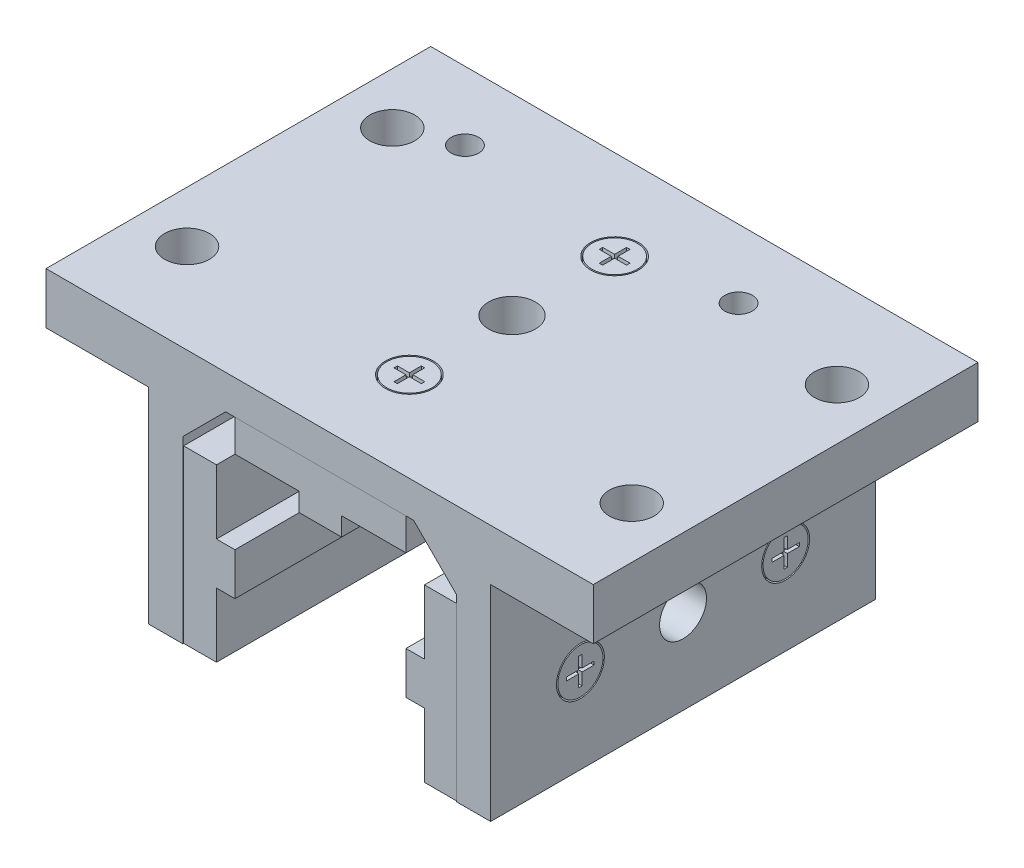
from build123d import *

# Parameters (mm, degrees)
BOSS_EXTRUDE1_DEPTH             = 35.7124
BOSS_EXTRUDE2_DEPTH             = 35.56
BOSS_EXTRUDE2_2_DEPTH           = 35.56
SKETCH11_W                      = 7.874
SKETCH11_H                      = 7.874
CUT_EXTRUDE5_DEPTH              = 77.234223048
SKETCH12_W                      = 7.874
SKETCH12_H                      = 7.874
CUT_EXTRUDE6_DEPTH              = 58.371600237
SKETCH3_R                       = 4.445
SKETCH3_R_2                     = 4.191
CUT_EXTRUDE1_DEPTH              = 3.175
CUT_EXTRUDE2_DEPTH              = 0.762
CUT_EXTRUDE2_DRAFT              = -5
SKETCH13_R                      = 4.445
SKETCH13_R_2                    = 4.191
CUT_EXTRUDE_THIN1_DEPTH         = 3.175
CUT_EXTRUDE7_DEPTH              = 0.762
CUT_EXTRUDE7_DRAFT              = -5
MIRROR4_COPY_1_DEPTH            = 0.762
MIRROR4_COPY_1_DRAFT            = -5
MIRROR3_COPY_1_DEPTH            = 0.762
MIRROR3_COPY_1_DRAFT            = -5
MIRROR3_COPY_2_DEPTH            = 0.762
MIRROR3_COPY_2_DRAFT            = -5
MIRROR3_COPY_3_SKETCH_R         = 4.445
MIRROR3_COPY_3_SKETCH_R_2       = 4.191
MIRROR3_COPY_3_DEPTH            = 3.175
MIRROR3_COPY_4_DEPTH            = 0.762
MIRROR3_COPY_4_DRAFT            = -5
SKETCH9_R                       = 4.3561
CUT_EXTRUDE4_DEPTH              = 68.46538845
CUT_EXTRUDE8_DEPTH              = 68.46538845
CUT_EXTRUDE8_DEPTH_BACK         = 68.46538845
SKETCH15_R                      = 4.3561
TOP_START                       = -35.7124
SKETCH16_W                      = 22.225
SKETCH16_H                      = 9.525
TOP_FLANGE_DEPTH                = 71.4248
SKETCH17_R                      = 4.1656
TOP_FLANGE_HOLE_DEPTH           = 79.256987795
F_1_4_20_START                  = 41.275
F_1_4_20_TAPPED_HOLE1_OUTLINE_R = 2.5527
F_1_4_20_TAPPED_HOLE1_DEPTH     = 6.35


# Read off the part's stored shape, not the designer's step: 1/4-20 Tapped Hole1
with BuildPart() as part:
    # Sketch1 → Boss-Extrude1 (new, symmetric)
    with BuildSketch(Plane.XY):
        Polygon((-25.4, 0), (-25.4, 33.3248), (-17.4498, 41.275), (17.4498, 41.275), (25.4, 33.3248), (25.4, 0), (31.75, 0), (31.75, 47.625), (-31.75, 47.625), (-31.75, 0), align=None)
    extrude(amount=BOSS_EXTRUDE1_DEPTH, both=True)

    # Sketch3 → Cut-Extrude1 (cut)
    with BuildSketch(Plane(origin=(0, 47.625, 0), x_dir=(1, 0, 0), z_dir=(0, 1, 0))):
        with Locations(Location((0, -19.05, 0), (0, 0, 270))):
            Circle(SKETCH3_R)
        with Locations(Location((0, -19.05, 0), (0, 0, 270))):
            Circle(SKETCH3_R_2, mode=Mode.SUBTRACT)
    cut_extrude1 = extrude(amount=-CUT_EXTRUDE1_DEPTH, mode=Mode.SUBTRACT)


with BuildPart() as body_2:
    # Sketch2 → Boss-Extrude2 (new, symmetric)
    with BuildSketch(Plane.XY):
        Polygon((-19.304, 19.812), (-19.304, 31.75), (-25.4, 31.75), (-25.4, 0), (-19.304, 0), (-19.304, 11.938), (-15.875, 11.938), (-15.875, 19.812), align=None)
    extrude(amount=BOSS_EXTRUDE2_DEPTH, both=True)

    # Sketch11 → Cut-Extrude5 (cut, through all)
    with BuildSketch(Plane(origin=(-15.875, 0, 0), x_dir=(0, 0, -1), z_dir=(1, 0, 0))):
        with Locations((0, 15.875)):
            Rectangle(SKETCH11_W, SKETCH11_H)
    extrude(amount=-CUT_EXTRUDE5_DEPTH, mode=Mode.SUBTRACT)


with BuildPart() as body_3:
    # Sketch2 → Boss-Extrude2 2 (new, symmetric)
    with BuildSketch(Plane.XY):
        Polygon((-15.875, 41.275), (15.875, 41.275), (15.875, 35.179), (3.937, 35.179), (3.937, 31.75), (-3.937, 31.75), (-3.937, 35.179), (-15.875, 35.179), align=None)
    extrude(amount=BOSS_EXTRUDE2_2_DEPTH, both=True)

    # Sketch12 → Cut-Extrude6 (cut, through all)
    with BuildSketch(Plane.XZ.offset(-31.75)):
        Rectangle(SKETCH12_W, SKETCH12_H)
    extrude(amount=-CUT_EXTRUDE6_DEPTH, mode=Mode.SUBTRACT)


with BuildPart() as body_4:
    # Mirror1: mirrored copy
    add(body_2.part.mirror(Plane(origin=(0, 0, 0), x_dir=(0, 0, 1), z_dir=(1, 0, 0))))


with BuildPart() as cut_extrude2_tool:
    # Sketch5 → Cut-Extrude2 (with draft: the straight prism first)
    with BuildSketch(Plane(origin=(0, 47.625, 0), x_dir=(1, 0, 0), z_dir=(0, 1, 0))):
        Polygon((0.3175, -18.7325), (0.3175, -16.51), (-0.3175, -16.51), (-0.3175, -18.7325), (-2.54, -18.7325), (-2.54, -19.3675), (-0.3175, -19.3675), (-0.3175, -21.59), (0.3175, -21.59), (0.3175, -19.3675), (2.54, -19.3675), (2.54, -18.7325), align=None)
    extrude(amount=-CUT_EXTRUDE2_DEPTH)
    # Cut-Extrude2: the draft: its side faces are tilted about the plane it starts from
    cut_extrude2_sides = [cut_extrude2_tool.faces().sort_by_distance(p)[0] for p in [
        (0.3175, 47.244, 17.62125),
        (0, 47.244, 16.51),
        (-0.3175, 47.244, 17.62125),
        (-1.42875, 47.244, 18.7325),
        (-2.54, 47.244, 19.05),
        (-1.42875, 47.244, 19.3675),
        (-0.3175, 47.244, 20.47875),
        (0, 47.244, 21.59),
        (0.3175, 47.244, 20.47875),
        (1.42875, 47.244, 19.3675),
        (2.54, 47.244, 19.05),
        (1.42875, 47.244, 18.7325),
    ]]
    draft(cut_extrude2_sides, Plane(origin=(0, 47.625, 0), x_dir=(1, 0, 0), z_dir=(0, 1, 0)), CUT_EXTRUDE2_DRAFT)


with BuildPart() as part_1:
    add(part.part)

    # Cut-Extrude2: cut by cut_extrude2_tool
    add(cut_extrude2_tool.part, mode=Mode.SUBTRACT)

    # Sketch13 → Cut-Extrude-Thin1 (cut)
    with BuildSketch(Plane(origin=(31.75, 0, 0), x_dir=(0, 0, -1), z_dir=(1, 0, 0))):
        with Locations((-19.05, 15.875)):
            Circle(SKETCH13_R)
        with Locations((-19.05, 15.875)):
            Circle(SKETCH13_R_2, mode=Mode.SUBTRACT)
    cut_extrude_thin1 = extrude(amount=-CUT_EXTRUDE_THIN1_DEPTH, mode=Mode.SUBTRACT)


with BuildPart() as cut_extrude7_tool:
    # Sketch14 → Cut-Extrude7 (with draft: the straight prism first)
    with BuildSketch(Plane(origin=(31.75, 0, 0), x_dir=(0, 0, -1), z_dir=(1, 0, 0))):
        Polygon((-19.3675, 15.5575), (-19.3675, 13.335), (-18.7325, 13.335), (-18.7325, 15.5575), (-16.51, 15.5575), (-16.51, 16.1925), (-18.7325, 16.1925), (-18.7325, 18.415), (-19.3675, 18.415), (-19.3675, 16.1925), (-21.59, 16.1925), (-21.59, 15.5575), align=None)
    extrude(amount=-CUT_EXTRUDE7_DEPTH)
    # Cut-Extrude7: the draft: its side faces are tilted about the plane it starts from
    cut_extrude7_sides = [cut_extrude7_tool.faces().sort_by_distance(p)[0] for p in [
        (31.369, 14.44625, 19.3675),
        (31.369, 13.335, 19.05),
        (31.369, 14.44625, 18.7325),
        (31.369, 15.5575, 17.62125),
        (31.369, 15.875, 16.51),
        (31.369, 16.1925, 17.62125),
        (31.369, 17.30375, 18.7325),
        (31.369, 18.415, 19.05),
        (31.369, 17.30375, 19.3675),
        (31.369, 16.1925, 20.47875),
        (31.369, 15.875, 21.59),
        (31.369, 15.5575, 20.47875),
    ]]
    draft(cut_extrude7_sides, Plane(origin=(31.75, 0, 0), x_dir=(0, 0, -1), z_dir=(1, 0, 0)), CUT_EXTRUDE7_DRAFT)


with BuildPart() as part_2:
    add(part_1.part)

    # Cut-Extrude7: cut by cut_extrude7_tool
    add(cut_extrude7_tool.part, mode=Mode.SUBTRACT)

    # Mirror4: Cut-Extrude-Thin1 across plane
    add(cut_extrude_thin1.mirror(Plane(origin=(0, 0, 0), x_dir=(0, 0, 1), z_dir=(1, 0, 0))), mode=Mode.SUBTRACT)


with BuildPart() as mirror4_copy_1_tool:
    # Mirror4 copy 1 sketch → Mirror4 copy 1 (with draft: the straight prism first)
    with BuildSketch(Plane(origin=(-31.75, 0, 0), x_dir=(0, 0, -1), z_dir=(-1, 0, 0))):
        Polygon((-19.3675, -15.5575), (-19.3675, -13.335), (-18.7325, -13.335), (-18.7325, -15.5575), (-16.51, -15.5575), (-16.51, -16.1925), (-18.7325, -16.1925), (-18.7325, -18.415), (-19.3675, -18.415), (-19.3675, -16.1925), (-21.59, -16.1925), (-21.59, -15.5575), align=None)
    extrude(amount=-MIRROR4_COPY_1_DEPTH)
    # Mirror4 copy 1: the draft: its side faces are tilted about the plane it starts from
    mirror4_copy_1_sides = [mirror4_copy_1_tool.faces().sort_by_distance(p)[0] for p in [
        (-31.369, 14.44625, 19.3675),
        (-31.369, 13.335, 19.05),
        (-31.369, 14.44625, 18.7325),
        (-31.369, 15.5575, 17.62125),
        (-31.369, 15.875, 16.51),
        (-31.369, 16.1925, 17.62125),
        (-31.369, 17.30375, 18.7325),
        (-31.369, 18.415, 19.05),
        (-31.369, 17.30375, 19.3675),
        (-31.369, 16.1925, 20.47875),
        (-31.369, 15.875, 21.59),
        (-31.369, 15.5575, 20.47875),
    ]]
    draft(mirror4_copy_1_sides, Plane(origin=(-31.75, 0, 0), x_dir=(0, 0, -1), z_dir=(-1, 0, 0)), MIRROR4_COPY_1_DRAFT)


with BuildPart() as part_3:
    add(part_2.part)

    # Mirror4 copy 1: cut by mirror4_copy_1_tool
    add(mirror4_copy_1_tool.part, mode=Mode.SUBTRACT)

    # Mirror3: Cut-Extrude1, Cut-Extrude-Thin1 across plane
    add(cut_extrude1.mirror(Plane.XY), mode=Mode.SUBTRACT)
    add(cut_extrude_thin1.mirror(Plane.XY), mode=Mode.SUBTRACT)


with BuildPart() as mirror3_copy_1_tool:
    # Mirror3 copy 1 sketch → Mirror3 copy 1 (with draft: the straight prism first)
    with BuildSketch(Plane(origin=(0, 47.625, 0), x_dir=(1, 0, 0), z_dir=(0, 1, 0))):
        Polygon((0.3175, 18.7325), (0.3175, 16.51), (-0.3175, 16.51), (-0.3175, 18.7325), (-2.54, 18.7325), (-2.54, 19.3675), (-0.3175, 19.3675), (-0.3175, 21.59), (0.3175, 21.59), (0.3175, 19.3675), (2.54, 19.3675), (2.54, 18.7325), align=None)
    extrude(amount=-MIRROR3_COPY_1_DEPTH)
    # Mirror3 copy 1: the draft: its side faces are tilted about the plane it starts from
    mirror3_copy_1_sides = [mirror3_copy_1_tool.faces().sort_by_distance(p)[0] for p in [
        (0.3175, 47.244, -17.62125),
        (0, 47.244, -16.51),
        (-0.3175, 47.244, -17.62125),
        (-1.42875, 47.244, -18.7325),
        (-2.54, 47.244, -19.05),
        (-1.42875, 47.244, -19.3675),
        (-0.3175, 47.244, -20.47875),
        (0, 47.244, -21.59),
        (0.3175, 47.244, -20.47875),
        (1.42875, 47.244, -19.3675),
        (2.54, 47.244, -19.05),
        (1.42875, 47.244, -18.7325),
    ]]
    draft(mirror3_copy_1_sides, Plane(origin=(0, 47.625, 0), x_dir=(1, 0, 0), z_dir=(0, 1, 0)), MIRROR3_COPY_1_DRAFT)


with BuildPart() as part_4:
    add(part_3.part)

    # Mirror3 copy 1: cut by mirror3_copy_1_tool
    add(mirror3_copy_1_tool.part, mode=Mode.SUBTRACT)


with BuildPart() as mirror3_copy_2_tool:
    # Mirror3 copy 2 sketch → Mirror3 copy 2 (with draft: the straight prism first)
    with BuildSketch(Plane(origin=(31.75, 0, 0), x_dir=(0, 0, 1), z_dir=(1, 0, 0))):
        Polygon((-19.3675, -15.5575), (-19.3675, -13.335), (-18.7325, -13.335), (-18.7325, -15.5575), (-16.51, -15.5575), (-16.51, -16.1925), (-18.7325, -16.1925), (-18.7325, -18.415), (-19.3675, -18.415), (-19.3675, -16.1925), (-21.59, -16.1925), (-21.59, -15.5575), align=None)
    extrude(amount=-MIRROR3_COPY_2_DEPTH)
    # Mirror3 copy 2: the draft: its side faces are tilted about the plane it starts from
    mirror3_copy_2_sides = [mirror3_copy_2_tool.faces().sort_by_distance(p)[0] for p in [
        (31.369, 14.44625, -19.3675),
        (31.369, 13.335, -19.05),
        (31.369, 14.44625, -18.7325),
        (31.369, 15.5575, -17.62125),
        (31.369, 15.875, -16.51),
        (31.369, 16.1925, -17.62125),
        (31.369, 17.30375, -18.7325),
        (31.369, 18.415, -19.05),
        (31.369, 17.30375, -19.3675),
        (31.369, 16.1925, -20.47875),
        (31.369, 15.875, -21.59),
        (31.369, 15.5575, -20.47875),
    ]]
    draft(mirror3_copy_2_sides, Plane(origin=(31.75, 0, 0), x_dir=(0, 0, 1), z_dir=(1, 0, 0)), MIRROR3_COPY_2_DRAFT)


with BuildPart() as part_5:
    add(part_4.part)

    # Mirror3 copy 2: cut by mirror3_copy_2_tool
    add(mirror3_copy_2_tool.part, mode=Mode.SUBTRACT)

    # Mirror3 copy 3 sketch → Mirror3 copy 3 (cut)
    with BuildSketch(Plane.ZY.offset(31.75)):
        with Locations((-19.05, 15.875)):
            Circle(MIRROR3_COPY_3_SKETCH_R)
        with Locations((-19.05, 15.875)):
            Circle(MIRROR3_COPY_3_SKETCH_R_2, mode=Mode.SUBTRACT)
    extrude(amount=-MIRROR3_COPY_3_DEPTH, mode=Mode.SUBTRACT)


with BuildPart() as mirror3_copy_4_tool:
    # Mirror3 copy 4 sketch → Mirror3 copy 4 (with draft: the straight prism first)
    with BuildSketch(Plane.ZY.offset(31.75)):
        Polygon((-19.3675, 15.5575), (-19.3675, 13.335), (-18.7325, 13.335), (-18.7325, 15.5575), (-16.51, 15.5575), (-16.51, 16.1925), (-18.7325, 16.1925), (-18.7325, 18.415), (-19.3675, 18.415), (-19.3675, 16.1925), (-21.59, 16.1925), (-21.59, 15.5575), align=None)
    extrude(amount=-MIRROR3_COPY_4_DEPTH)
    # Mirror3 copy 4: the draft: its side faces are tilted about the plane it starts from
    mirror3_copy_4_sides = [mirror3_copy_4_tool.faces().sort_by_distance(p)[0] for p in [
        (-31.369, 14.44625, -19.3675),
        (-31.369, 13.335, -19.05),
        (-31.369, 14.44625, -18.7325),
        (-31.369, 15.5575, -17.62125),
        (-31.369, 15.875, -16.51),
        (-31.369, 16.1925, -17.62125),
        (-31.369, 17.30375, -18.7325),
        (-31.369, 18.415, -19.05),
        (-31.369, 17.30375, -19.3675),
        (-31.369, 16.1925, -20.47875),
        (-31.369, 15.875, -21.59),
        (-31.369, 15.5575, -20.47875),
    ]]
    draft(mirror3_copy_4_sides, Plane.ZY.offset(31.75), MIRROR3_COPY_4_DRAFT)


with BuildPart() as part_6:
    add(part_5.part)

    # Mirror3 copy 4: cut by mirror3_copy_4_tool
    add(mirror3_copy_4_tool.part, mode=Mode.SUBTRACT)

    # Sketch9 → Cut-Extrude4 (cut, through all)
    with BuildSketch(Plane(origin=(0, 47.625, 0), x_dir=(1, 0, 0), z_dir=(0, 1, 0))):
        with Locations(Location((0, 0, 0), (0, 0, 270))):
            Circle(SKETCH9_R)
    extrude(amount=-CUT_EXTRUDE4_DEPTH, mode=Mode.SUBTRACT)

    # Sketch15 → Cut-Extrude8 (cut, two sides: drawn at the far end of the back side and taken through both)
    with BuildSketch(Plane(origin=(0, 0, 0), x_dir=(0, 0, -1), z_dir=(1, 0, 0)).offset(-CUT_EXTRUDE8_DEPTH_BACK)):
        with Locations((0, 15.875)):
            Circle(SKETCH15_R)
    extrude(amount=CUT_EXTRUDE8_DEPTH + CUT_EXTRUDE8_DEPTH_BACK, mode=Mode.SUBTRACT)

    # Sketch16 → Top Flange (add)
    with BuildSketch(Plane.XY.offset(TOP_START)):
        with Locations((-39.6875, 42.8625)):
            Rectangle(SKETCH16_W, SKETCH16_H)
        with Locations((39.6875, 42.8625)):
            Rectangle(SKETCH16_W, SKETCH16_H)
    extrude(amount=TOP_FLANGE_DEPTH)

    # Sketch17 → Top Flange Hole (cut, through all)
    with BuildSketch(Plane(origin=(0, 47.625, 0), x_dir=(1, 0, 0), z_dir=(0, 1, 0))):
        with Locations(Location((41.275, 19.05, 0), (0, 0, 270))):
            Circle(SKETCH17_R)
        with Locations(Location((41.275, -19.05, 0), (0, 0, 270))):
            Circle(SKETCH17_R)
        with Locations(Location((-41.275, 19.05, 0), (0, 0, 270))):
            Circle(SKETCH17_R)
        with Locations(Location((-41.275, -19.05, 0), (0, 0, 270))):
            Circle(SKETCH17_R)
    extrude(amount=-TOP_FLANGE_HOLE_DEPTH, mode=Mode.SUBTRACT)

    # 1/4-20 Tapped Hole1 outline → 1/4-20 Tapped Hole1 (cut)
    with BuildSketch(Plane(origin=(0, 0, 0), x_dir=(1, 0, 0), z_dir=(0, 1, 0)).offset(F_1_4_20_START)):
        with Locations((19.05, 23.0124)):
            Circle(F_1_4_20_TAPPED_HOLE1_OUTLINE_R)
    extrude(amount=F_1_4_20_TAPPED_HOLE1_DEPTH, mode=Mode.SUBTRACT)

    # 1_4-20 Tapped Hole1 2 outline → 1_4-20 Tapped Hole1 2 (revolve, cut)
    with BuildSketch(Plane(origin=(-31.75, 0, -23.0124), x_dir=(1, 0, 0), z_dir=(0, 0, 1))):
        Polygon((0, 47.625), (0, 39.741183098), (2.5527, 41.275), (2.5527, 47.625), align=None)
    revolve(axis=Axis((-31.75, 0, -23.0124), (0, 1, 0)), mode=Mode.SUBTRACT)


solid = Compound([body_2.part, body_3.part, body_4.part, part_6.part])
